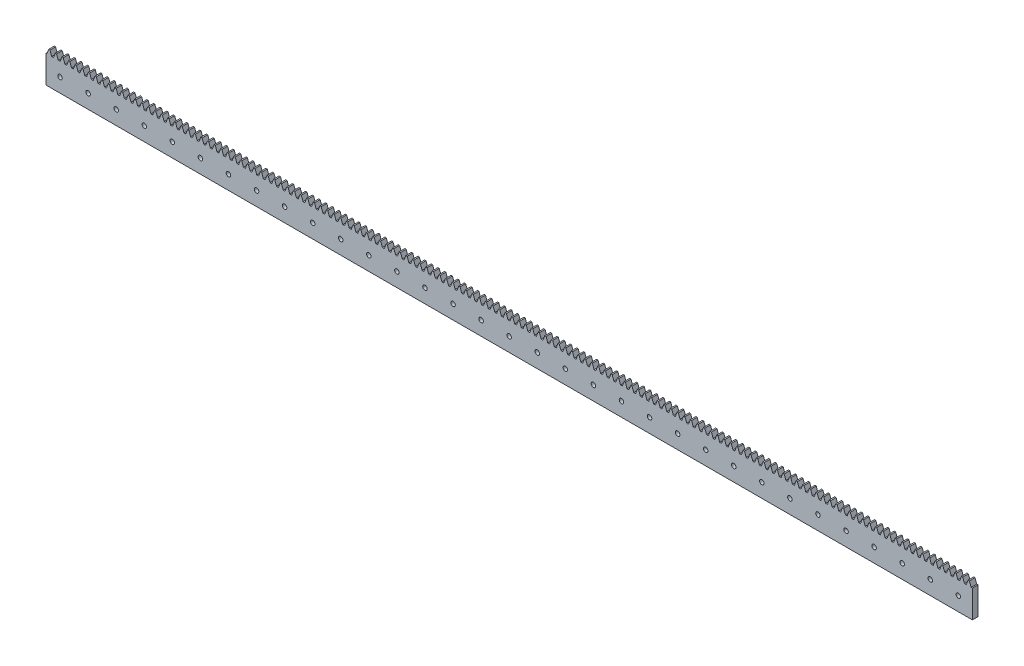
from build123d import *

# Parameters (mm, degrees)
BLANKSKE_W          = 660
BLANKSKE_H          = 23
BLANK_DEPTH         = 4
TOOTHCUTSIM_DEPTH   = 661.412749726
TEETHCUTS_COUNT     = 142
TEETHCUTS_PITCH     = 4.712388975
SKETCH_1_R          = 1.6
CUT_EXTRUDE_1_DEPTH = 661.412749726


with BuildPart() as part:
    # BlankSke → Blank (new body)
    with BuildSketch(Plane.XY):
        with Locations((330, 11.5)):
            Rectangle(BLANKSKE_W, BLANKSKE_H)
    extrude(amount=-BLANK_DEPTH)

    # TooCutSkeSim → ToothCutSim (cut, through all)
    with BuildSketch(Plane.XY):
        Polygon((0.654653055, 19.625), (-0.654653055, 19.625), (-1.892297439, 23.0254), (1.892297439, 23.0254), align=None)
    toothcutsim = extrude(amount=-TOOTHCUTSIM_DEPTH, mode=Mode.SUBTRACT)

    # TeethCuts: ToothCutSim ×142
    with Locations(*[(i * TEETHCUTS_PITCH, 0, 0) for i in range(1, TEETHCUTS_COUNT)]):
        add(toothcutsim, mode=Mode.SUBTRACT)

    # 草图1 → 切除-拉伸1 (cut, through all)
    with BuildSketch(Plane(origin=(0, 0, -4), x_dir=(-1, 0, 0), z_dir=(0, 0, -1))):
        with Locations((-650, 10)):
            Circle(SKETCH_1_R)
        with Locations((-630, 10)):
            Circle(SKETCH_1_R)
        with Locations((-610, 10)):
            Circle(SKETCH_1_R)
        with Locations((-590, 10)):
            Circle(SKETCH_1_R)
        with Locations((-570, 10)):
            Circle(SKETCH_1_R)
        with Locations((-550, 10)):
            Circle(SKETCH_1_R)
        with Locations((-530, 10)):
            Circle(SKETCH_1_R)
        with Locations((-510, 10)):
            Circle(SKETCH_1_R)
        with Locations((-490, 10)):
            Circle(SKETCH_1_R)
        with Locations((-470, 10)):
            Circle(SKETCH_1_R)
        with Locations((-450, 10)):
            Circle(SKETCH_1_R)
        with Locations((-430, 10)):
            Circle(SKETCH_1_R)
        with Locations((-410, 10)):
            Circle(SKETCH_1_R)
        with Locations((-390, 10)):
            Circle(SKETCH_1_R)
        with Locations((-370, 10)):
            Circle(SKETCH_1_R)
        with Locations((-350, 10)):
            Circle(SKETCH_1_R)
        with Locations((-330, 10)):
            Circle(SKETCH_1_R)
        with Locations((-310, 10)):
            Circle(SKETCH_1_R)
        with Locations((-290, 10)):
            Circle(SKETCH_1_R)
        with Locations((-270, 10)):
            Circle(SKETCH_1_R)
        with Locations((-250, 10)):
            Circle(SKETCH_1_R)
        with Locations((-230, 10)):
            Circle(SKETCH_1_R)
        with Locations((-210, 10)):
            Circle(SKETCH_1_R)
        with Locations((-190, 10)):
            Circle(SKETCH_1_R)
        with Locations((-170, 10)):
            Circle(SKETCH_1_R)
        with Locations((-150, 10)):
            Circle(SKETCH_1_R)
        with Locations((-130, 10)):
            Circle(SKETCH_1_R)
        with Locations((-110, 10)):
            Circle(SKETCH_1_R)
        with Locations((-90, 10)):
            Circle(SKETCH_1_R)
        with Locations((-70, 10)):
            Circle(SKETCH_1_R)
        with Locations((-50, 10)):
            Circle(SKETCH_1_R)
        with Locations((-30, 10)):
            Circle(SKETCH_1_R)
        with Locations((-10, 10)):
            Circle(SKETCH_1_R)
    extrude(amount=-CUT_EXTRUDE_1_DEPTH, mode=Mode.SUBTRACT)


solid = part.part
